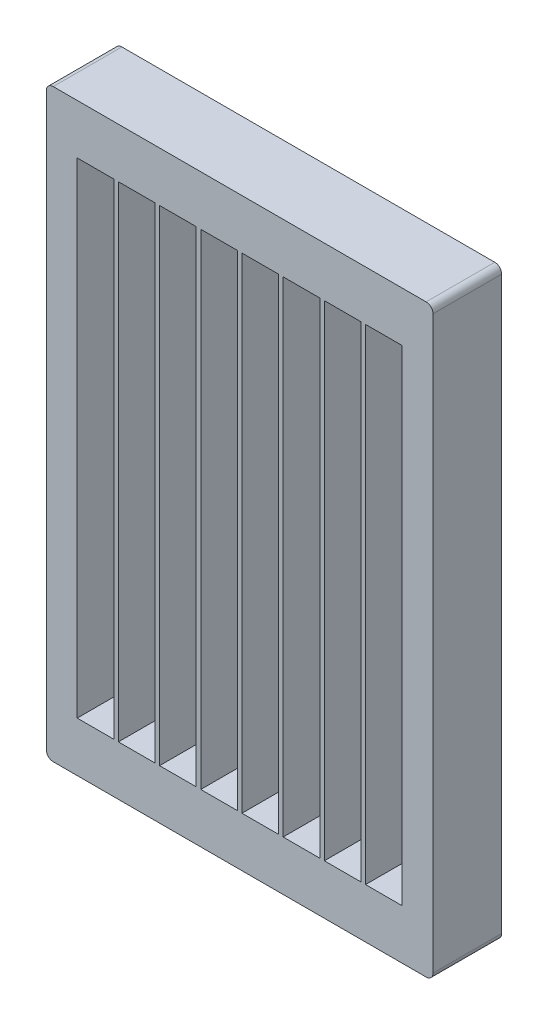
from build123d import *

# Parameters (mm, degrees)
SKIZZE1_W                       = 10
SKIZZE1_H                       = 54
AUFSATZ_LINEAR_AUSTRAGEN1_DEPTH = 15
SCHALE1_T                       = -1
LINEARES_MUSTER1_COUNT          = 8
LINEARES_MUSTER1_PITCH          = 9
SKIZZE2_W                       = 84.48
SKIZZE2_H                       = 127.76
SKIZZE2_W_2                     = 73
SKIZZE2_H_2                     = 108
AUFSATZ_LINEAR_AUSTRAGEN2_DEPTH = 15
VERRUNDUNG1_R                   = 1.5


with BuildPart() as part:
    # Skizze1 → Aufsatz-Linear austragen1 (new body)
    with BuildSketch(Plane.XY):
        with Locations((-5, 27)):
            Rectangle(SKIZZE1_W, SKIZZE1_H)
    extrude(amount=AUFSATZ_LINEAR_AUSTRAGEN1_DEPTH)

    # Schale1
    schale1_openings = [part.faces().sort_by_distance(p)[0] for p in [
        (-5, 27, 15),
        (-5, 0, 7.5),
    ]]
    offset(amount=SCHALE1_T, openings=schale1_openings, kind=Kind.INTERSECTION)


with BuildPart() as lineares_muster1_1:
    # Lineares Muster1: pattern copy
    add(part.part.moved(Location(Vector(-1, 0, 0) * (1 * LINEARES_MUSTER1_PITCH))))


with BuildPart() as lineares_muster1_2:
    # Lineares Muster1: pattern copy
    add(part.part.moved(Location(Vector(-1, 0, 0) * (2 * LINEARES_MUSTER1_PITCH))))


with BuildPart() as lineares_muster1_3:
    # Lineares Muster1: pattern copy
    add(part.part.moved(Location(Vector(-1, 0, 0) * (3 * LINEARES_MUSTER1_PITCH))))


with BuildPart() as lineares_muster1_4:
    # Lineares Muster1: pattern copy
    add(part.part.moved(Location(Vector(-1, 0, 0) * (4 * LINEARES_MUSTER1_PITCH))))


with BuildPart() as lineares_muster1_5:
    # Lineares Muster1: pattern copy
    add(part.part.moved(Location(Vector(-1, 0, 0) * (5 * LINEARES_MUSTER1_PITCH))))


with BuildPart() as lineares_muster1_6:
    # Lineares Muster1: pattern copy
    add(part.part.moved(Location(Vector(-1, 0, 0) * (6 * LINEARES_MUSTER1_PITCH))))


with BuildPart() as lineares_muster1_7:
    # Lineares Muster1: pattern copy
    add(part.part.moved(Location(Vector(-1, 0, 0) * (7 * LINEARES_MUSTER1_PITCH))))


with BuildPart() as part_1:
    add(part.part)

    # Kombinieren1: read off the stored shape, not the designer's step
    # Kombinieren1: union Lineares Muster1_1, Lineares Muster1_2, Lineares Muster1_3, Lineares Muster1_4, Lineares Muster1_5, Lineares Muster1_6, Lineares Muster1_7
    add(lineares_muster1_1.part)
    add(lineares_muster1_2.part)
    add(lineares_muster1_3.part)
    add(lineares_muster1_4.part)
    add(lineares_muster1_5.part)
    add(lineares_muster1_6.part)
    add(lineares_muster1_7.part)

    # Spiegeln1: part across plane


with BuildPart() as part_2:
    add(part_1.part)
    add(part_1.part.mirror(Plane(origin=(-63, 0, 15), x_dir=(0, 0, 1), z_dir=(0, 1, 0))))

    # Skizze2 → Aufsatz-Linear austragen2 (add)
    with BuildSketch(Plane.XY.offset(15)):
        with Locations((-36.5, 0)):
            Rectangle(SKIZZE2_W, SKIZZE2_H)
        with Locations((-36.5, 0)):
            Rectangle(SKIZZE2_W_2, SKIZZE2_H_2, mode=Mode.SUBTRACT)
    extrude(amount=-AUFSATZ_LINEAR_AUSTRAGEN2_DEPTH)

    # Verrundung1
    verrundung1_edges = [part_2.edges().sort_by_distance(p)[0] for p in [
        (-78.74, 63.88, 7.5),
        (-78.74, -63.88, 7.5),
        (5.74, -63.88, 7.5),
        (5.74, 63.88, 7.5),
    ]]
    fillet(verrundung1_edges, radius=VERRUNDUNG1_R)


solid = part_2.part
